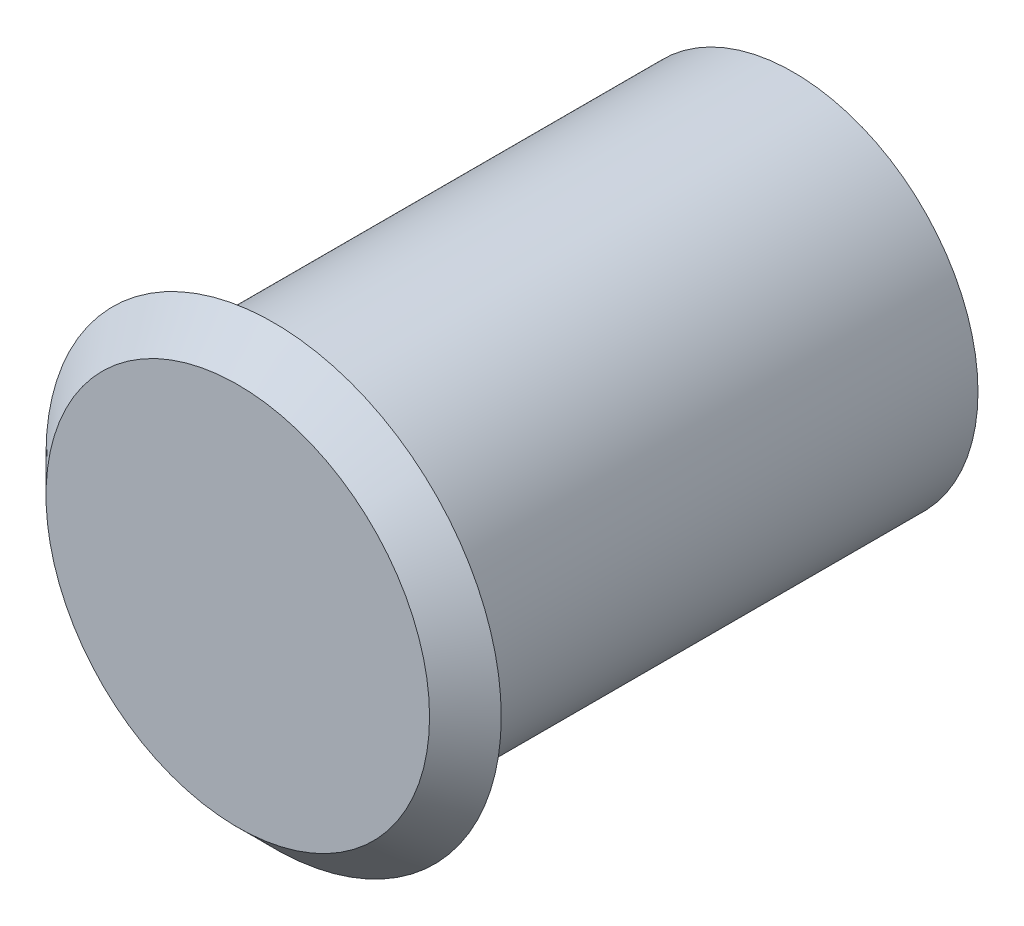
from build123d import *

# Parameters (mm, degrees)
SKETCH2_R           = 10.3
BOSS_EXTRUDE1_DEPTH = 29
SKETCH3_R           = 12.7
BOSS_EXTRUDE2_DEPTH = 2
CHAMFER1_SIZE       = 2


with BuildPart() as part:
    # Sketch2 → Boss-Extrude1 (new body)
    with BuildSketch(Plane.XY):
        with Locations(Location((0, 0, 0), (0, 0, 180))):
            Circle(SKETCH2_R)
    extrude(amount=BOSS_EXTRUDE1_DEPTH)

    # Sketch3 → Boss-Extrude2 (add)
    with BuildSketch(Plane.XY.offset(29)):
        Circle(SKETCH3_R)
    extrude(amount=BOSS_EXTRUDE2_DEPTH)

    # Chamfer1
    chamfer1_edges = [part.edges().sort_by_distance(p)[0] for p in [
        (-12.7, 0, 31),
    ]]
    chamfer(chamfer1_edges, length=CHAMFER1_SIZE - 0.0001)  # a hair under: the kernel refuses the full size


solid = part.part
